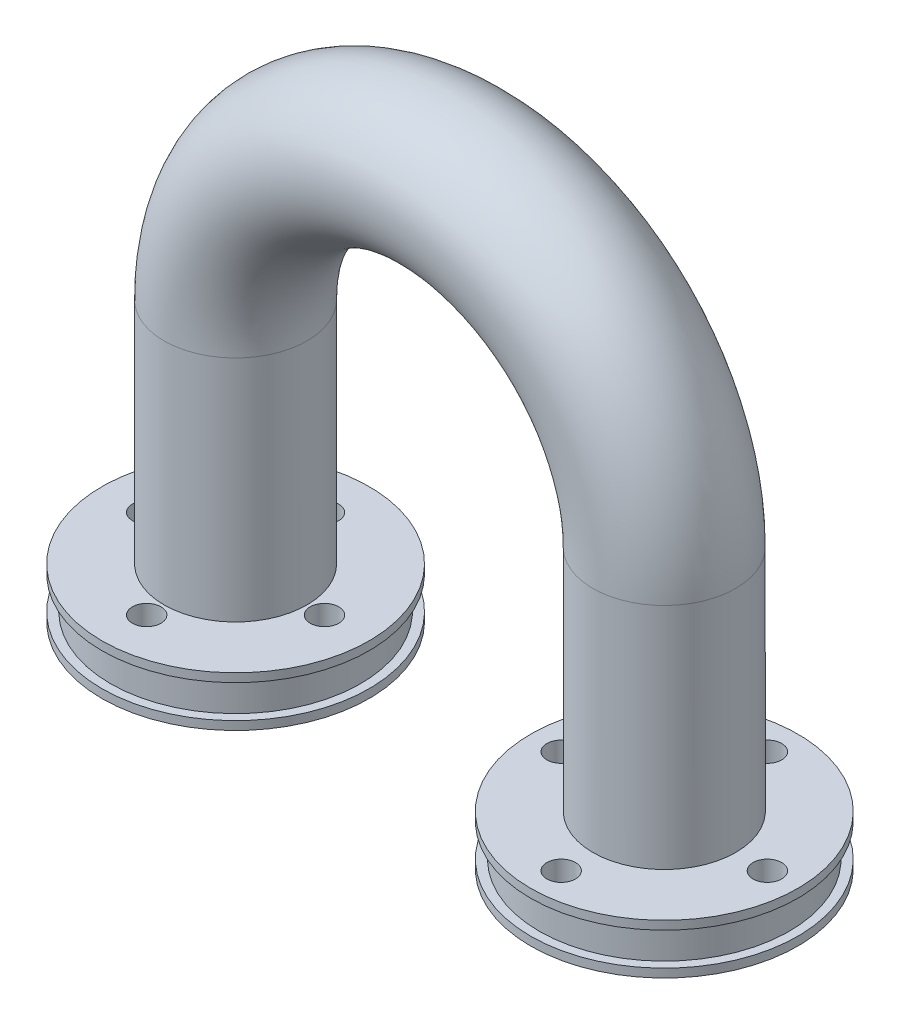
from build123d import *

# Parameters (mm, degrees)
SKETCH3_R             = 18.7
BOSS_EXTRUDE1_DEPTH   = 1.2
BOSS_EXTRUDE1_2_DEPTH = 1.2
SKETCH4_R             = 17.5
BOSS_EXTRUDE2_DEPTH   = 4.6
SKETCH5_R             = 18.7
BOSS_EXTRUDE3_DEPTH   = 1.2
SKETCH6_R             = 2
CUT_EXTRUDE1_DEPTH    = 82.193472644
SKETCH7_R             = 6
CUT_EXTRUDE2_DEPTH    = 82.193472644
SWEEP4_START          = 7
SWEEP4_OUTLINE_R      = 10
SWEEP4_DEPTH          = 32
SWEEP4_2_OUTLINE_R    = 6
SWEEP4_2_DEPTH        = 7
SWEEP4_3_OUTLINE_R    = 10
SWEEP4_3_ANGLE        = 180
SKETCH10_R            = 6
CUT_EXTRUDE3_DEPTH    = 7
SKETCH11_R            = 6


with BuildPart() as part:
    # Sketch3 → Boss-Extrude1 (new body)
    with BuildSketch(Plane(origin=(0, 0, 0), x_dir=(1, 0, 0), z_dir=(0, 1, 0))):
        with Locations(Location((0, 0, 0), (0, 0, 270))):
            Circle(SKETCH3_R)
    extrude(amount=BOSS_EXTRUDE1_DEPTH)



with BuildPart() as body_2:
    # Sketch3 → Boss-Extrude1 2 (new body)
    with BuildSketch(Plane(origin=(0, 0, 0), x_dir=(1, 0, 0), z_dir=(0, 1, 0))):
        with Locations(Location((60, 0, 0), (0, 0, 270))):
            Circle(SKETCH3_R)
    extrude(amount=BOSS_EXTRUDE1_2_DEPTH)


with BuildPart() as part_1:
    add(part.part)

    add(body_2.part)  # Boss-Extrude2 merges body 2
    # Sketch4 → Boss-Extrude2 (add)
    with BuildSketch(Plane(origin=(0, 1.2, 0), x_dir=(1, 0, 0), z_dir=(0, 1, 0))):
        with Locations(Location((0, 0, 0), (0, 0, 270))):
            Circle(SKETCH4_R)
        with Locations(Location((60, 0, 0), (0, 0, 270))):
            Circle(SKETCH4_R)
    extrude(amount=BOSS_EXTRUDE2_DEPTH)

    # Sketch5 → Boss-Extrude3 (add)
    with BuildSketch(Plane(origin=(0, 5.8, 0), x_dir=(1, 0, 0), z_dir=(0, 1, 0))):
        with Locations(Location((0, 0, 0), (0, 0, 270))):
            Circle(SKETCH5_R)
        with Locations(Location((60, 0, 0), (0, 0, 270))):
            Circle(SKETCH5_R)
    extrude(amount=BOSS_EXTRUDE3_DEPTH)

    # Sketch6 → Cut-Extrude1 (cut, through all)
    with BuildSketch(Plane(origin=(0, 7, 0), x_dir=(1, 0, 0), z_dir=(0, 1, 0))):
        with Locations(Location((0, 12.441407295, 0), (0, 0, 270))):
            Circle(SKETCH6_R)
        with Locations(Location((12.441407295, 0, 0), (0, 0, 270))):
            Circle(SKETCH6_R)
        with Locations(Location((0, -12.441407295, 0), (0, 0, 270))):
            Circle(SKETCH6_R)
        with Locations(Location((-12.441407295, 0, 0), (0, 0, 270))):
            Circle(SKETCH6_R)
        with Locations(Location((45.570995446, 0, 0), (0, 0, 270))):
            Circle(SKETCH6_R)
        with Locations(Location((60, 14.429004554, 0), (0, 0, 270))):
            Circle(SKETCH6_R)
        with Locations(Location((74.429004554, 0, 0), (0, 0, 270))):
            Circle(SKETCH6_R)
        with Locations(Location((60, -14.429004554, 0), (0, 0, 270))):
            Circle(SKETCH6_R)
    extrude(amount=-CUT_EXTRUDE1_DEPTH, mode=Mode.SUBTRACT)

    # Sketch7 → Cut-Extrude2 (cut, through all)
    with BuildSketch(Plane(origin=(0, 7, 0), x_dir=(1, 0, 0), z_dir=(0, 1, 0))):
        with Locations(Location((0, 0, 0), (0, 0, 270))):
            Circle(SKETCH7_R)
        with Locations(Location((60, 0, 0), (0, 0, 270))):
            Circle(SKETCH7_R)
    extrude(amount=-CUT_EXTRUDE2_DEPTH, mode=Mode.SUBTRACT)

    # Sweep4: read off the stored shape, not the designer's step
    # Sweep4 outline → Sweep4 (add)
    with BuildSketch(Plane(origin=(0, 0, 0), x_dir=(1, 0, 0), z_dir=(0, 1, 0)).offset(SWEEP4_START)):
        with Locations((60, 0)):
            Circle(SWEEP4_OUTLINE_R)
        Circle(SWEEP4_OUTLINE_R)
    extrude(amount=SWEEP4_DEPTH)

    # Sweep4 2 outline → Sweep4 2 (add)
    with BuildSketch(Plane(origin=(0, 0, 0), x_dir=(1, 0, 0), z_dir=(0, 1, 0))):
        with Locations((60, 0)):
            Circle(SWEEP4_2_OUTLINE_R)
    extrude(amount=SWEEP4_2_DEPTH)

    # Sweep4 3 outline → Sweep4 3 (revolve)
    with BuildSketch(Plane(origin=(30, 39, 0), x_dir=(1, 0, 0), z_dir=(0, -1, 0))):
        with Locations((30, 0)):
            Circle(SWEEP4_3_OUTLINE_R)
    revolve(axis=Axis((30, 39, 0), (0, 0, 1)), revolution_arc=SWEEP4_3_ANGLE)

    # Sketch10 → Cut-Extrude3 (cut)
    with BuildSketch(Plane(origin=(0, 0, 0), x_dir=(-1, 0, 0), z_dir=(0, -1, 0))):
        with Locations(Location((-60, 0, 0), (0, 0, 90))):
            Circle(SKETCH10_R)
    extrude(amount=-CUT_EXTRUDE3_DEPTH, mode=Mode.SUBTRACT)

    # Cut-Sweep3: sweep along a path in Sketch12
    with BuildLine(Plane.XY) as cut_sweep3_path:
        Line((0, 7), (0, 40))
        ThreePointArc((0, 40), (30, 70), (60, 40))
        Line((60, 40), (60, 7))
    # Sketch11 → Cut-Sweep3 (sweep, cut)
    with BuildSketch(Plane.XZ.offset(-7)):
        Circle(SKETCH11_R)
    sweep(path=cut_sweep3_path.line, mode=Mode.SUBTRACT)


solid = part_1.part
